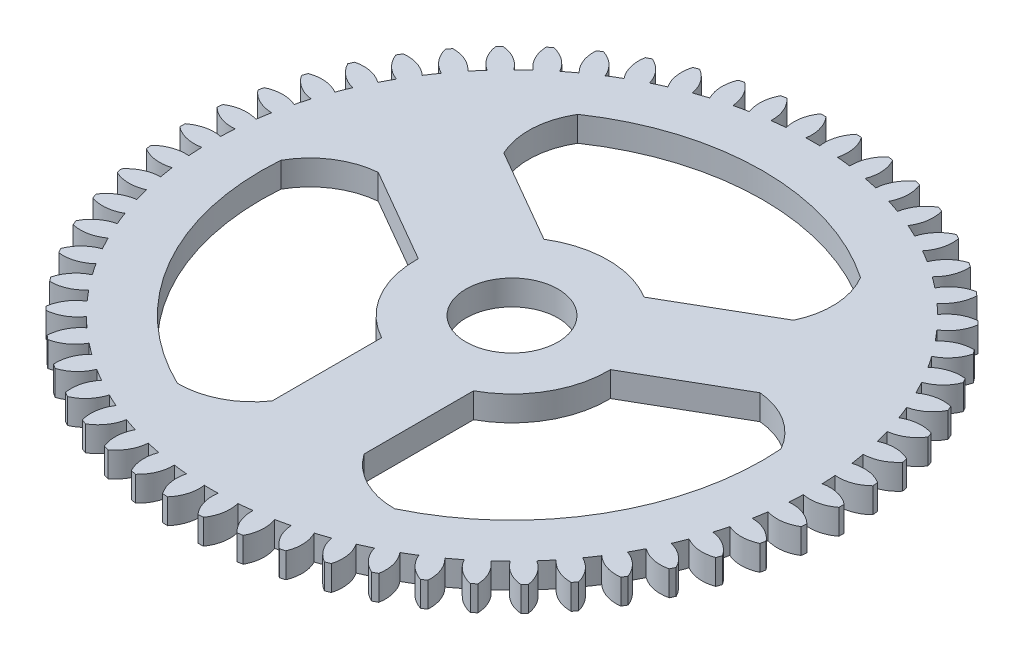
from build123d import *

# Parameters (mm, degrees)
SKETCH1_R           = 11
BOSS_EXTRUDE5_DEPTH = 6
BOSS_EXTRUDE6_DEPTH = 6
CIRPATTERN1_COUNT   = 58
CUT_EXTRUDE1_DEPTH  = 6


with BuildPart() as part:
    # Sketch1 → Boss-Extrude5 (new body)
    with BuildSketch(Plane(origin=(0, 0, 0), x_dir=(1, 0, 0), z_dir=(0, 1, 0))):
        with BuildLine():
            ThreePointArc((71.96481238, -2.250728579), (71.991202557, -1.125501811), (72, 0))
            ThreePointArc((72, 0), (71.991202557, 1.125501811), (71.96481238, 2.250728579))
            ThreePointArc((71.96481238, 2.250728579), (71.894405797, 3.898001418), (71.786298131, 5.543230164))
            ThreePointArc((71.786298131, 5.543230164), (71.577932915, 7.784569327), (71.299605002, 10.018299587))
            ThreePointArc((71.299605002, 10.018299587), (71.051509623, 11.648303752), (70.766155171, 13.272199601))
            ThreePointArc((70.766155171, 13.272199601), (70.316680011, 15.477871695), (69.798474945, 17.668415193))
            ThreePointArc((69.798474945, 17.668415193), (69.375599461, 19.262040374), (68.916343745, 20.845564633))
            ThreePointArc((68.916343745, 20.845564633), (68.231028325, 22.98971017), (67.479021586, 25.111384784))
            ThreePointArc((67.479021586, 25.111384784), (66.886323827, 26.649947184), (66.258551198, 28.174534479))
            ThreePointArc((66.258551198, 28.174534479), (65.345430216, 30.232015312), (64.368438396, 32.259946349))
            ThreePointArc((64.368438396, 32.259946349), (63.6128672, 33.72540773), (62.82393772, 35.173183669))
            ThreePointArc((62.82393772, 35.173183669), (61.693716684, 37.119877717), (60.503194119, 39.030289538))
            ThreePointArc((60.503194119, 39.030289538), (59.593607867, 40.405468706), (58.652771012, 41.759459439))
            ThreePointArc((58.652771012, 41.759459439), (57.318700731, 43.572543494), (55.928605209, 45.343038268))
            ThreePointArc((55.928605209, 45.343038268), (54.875667969, 46.611812504), (53.793954191, 47.856143728))
            ThreePointArc((53.793954191, 47.856143728), (52.271675418, 49.514361037), (50.698304539, 51.124181332))
            ThreePointArc((50.698304539, 51.124181332), (49.514361037, 52.271675418), (48.304452441, 53.391758487))
            ThreePointArc((48.304452441, 53.391758487), (46.611812504, 54.875667969), (44.873612602, 56.305940113))
            ThreePointArc((44.873612602, 56.305940113), (43.572543494, 57.318700731), (42.248625152, 58.301403695))
            ThreePointArc((42.248625152, 58.301403695), (40.405468706, 59.593607867), (38.522818586, 60.827563227))
            ThreePointArc((38.522818586, 60.827563227), (37.119877717, 61.693716684), (35.69747136, 62.52751825))
            ThreePointArc((35.69747136, 62.52751825), (33.72540773, 63.6128672), (31.720379744, 64.636038778))
            ThreePointArc((31.720379744, 64.636038778), (30.232015312, 65.345430216), (28.727797356, 66.020554822))
            ThreePointArc((28.727797356, 66.020554822), (26.649947184, 66.886323827), (24.546048451, 67.686715871))
            ThreePointArc((24.546048451, 67.686715871), (22.98971017, 68.231028325), (21.421316194, 68.739560753))
            ThreePointArc((21.421316194, 68.739560753), (19.262040374, 69.375599461), (17.083937183, 69.943828107))
            ThreePointArc((17.083937183, 69.943828107), (15.477871695, 70.316680011), (13.863689685, 70.652658183))
            ThreePointArc((13.863689685, 70.652658183), (11.648303752, 71.051509623), (9.421532371, 71.380912909))
            ThreePointArc((9.421532371, 71.380912909), (7.784569327, 71.577932915), (6.143524091, 71.737417794))
            ThreePointArc((6.143524091, 71.737417794), (3.898001418, 71.894405797), (1.648668707, 71.981121772))
            ThreePointArc((1.648668707, 71.981121772), (0, 72), (-1.648668707, 71.981121772))
            ThreePointArc((-1.648668707, 71.981121772), (-3.898001418, 71.894405797), (-6.143524091, 71.737417794))
            ThreePointArc((-6.143524091, 71.737417794), (-7.784569327, 71.577932915), (-9.421532371, 71.380912909))
            ThreePointArc((-9.421532371, 71.380912909), (-11.648303752, 71.051509623), (-13.863689685, 70.652658183))
            ThreePointArc((-13.863689685, 70.652658183), (-15.477871695, 70.316680011), (-17.083937183, 69.943828107))
            ThreePointArc((-17.083937183, 69.943828107), (-19.262040374, 69.375599461), (-21.421316194, 68.739560753))
            ThreePointArc((-21.421316194, 68.739560753), (-22.98971017, 68.231028325), (-24.546048451, 67.686715871))
            ThreePointArc((-24.546048451, 67.686715871), (-26.649947184, 66.886323827), (-28.727797356, 66.020554822))
            ThreePointArc((-28.727797356, 66.020554822), (-30.232015312, 65.345430216), (-31.720379744, 64.636038778))
            ThreePointArc((-31.720379744, 64.636038778), (-33.72540773, 63.6128672), (-35.69747136, 62.52751825))
            ThreePointArc((-35.69747136, 62.52751825), (-37.119877717, 61.693716684), (-38.522818586, 60.827563227))
            ThreePointArc((-38.522818586, 60.827563227), (-40.405468706, 59.593607867), (-42.248625152, 58.301403695))
            ThreePointArc((-42.248625152, 58.301403695), (-43.572543494, 57.318700731), (-44.873612602, 56.305940113))
            ThreePointArc((-44.873612602, 56.305940113), (-46.611812504, 54.875667969), (-48.304452441, 53.391758487))
            ThreePointArc((-48.304452441, 53.391758487), (-49.514361037, 52.271675418), (-50.698304539, 51.124181332))
            ThreePointArc((-50.698304539, 51.124181332), (-52.271675418, 49.514361037), (-53.793954191, 47.856143728))
            ThreePointArc((-53.793954191, 47.856143728), (-54.875667969, 46.611812504), (-55.928605209, 45.343038268))
            ThreePointArc((-55.928605209, 45.343038268), (-57.318700731, 43.572543494), (-58.652771012, 41.759459439))
            ThreePointArc((-58.652771012, 41.759459439), (-59.593607867, 40.405468706), (-60.503194119, 39.030289538))
            ThreePointArc((-60.503194119, 39.030289538), (-61.693716684, 37.119877717), (-62.82393772, 35.173183669))
            ThreePointArc((-62.82393772, 35.173183669), (-63.6128672, 33.72540773), (-64.368438396, 32.259946349))
            ThreePointArc((-64.368438396, 32.259946349), (-65.345430216, 30.232015312), (-66.258551198, 28.174534479))
            ThreePointArc((-66.258551198, 28.174534479), (-66.886323827, 26.649947184), (-67.479021586, 25.111384784))
            ThreePointArc((-67.479021586, 25.111384784), (-68.231028325, 22.98971017), (-68.916343745, 20.845564633))
            ThreePointArc((-68.916343745, 20.845564633), (-69.375599461, 19.262040374), (-69.798474945, 17.668415193))
            ThreePointArc((-69.798474945, 17.668415193), (-70.316680011, 15.477871695), (-70.766155171, 13.272199601))
            ThreePointArc((-70.766155171, 13.272199601), (-71.051509623, 11.648303752), (-71.299605002, 10.018299587))
            ThreePointArc((-71.299605002, 10.018299587), (-71.577932915, 7.784569327), (-71.786298131, 5.543230164))
            ThreePointArc((-71.786298131, 5.543230164), (-71.894405797, 3.898001418), (-71.96481238, 2.250728579))
            ThreePointArc((-71.96481238, 2.250728579), (-72, 0), (-71.96481238, -2.250728579))
            ThreePointArc((-71.96481238, -2.250728579), (-71.894405797, -3.898001418), (-71.786298131, -5.543230164))
            ThreePointArc((-71.786298131, -5.543230164), (-71.577932915, -7.784569327), (-71.299605002, -10.018299587))
            ThreePointArc((-71.299605002, -10.018299587), (-71.051509623, -11.648303752), (-70.766155171, -13.272199601))
            ThreePointArc((-70.766155171, -13.272199601), (-70.316680011, -15.477871695), (-69.798474945, -17.668415193))
            ThreePointArc((-69.798474945, -17.668415193), (-69.375599461, -19.262040374), (-68.916343745, -20.845564633))
            ThreePointArc((-68.916343745, -20.845564633), (-68.231028325, -22.98971017), (-67.479021586, -25.111384784))
            ThreePointArc((-67.479021586, -25.111384784), (-66.886323827, -26.649947184), (-66.258551198, -28.174534479))
            ThreePointArc((-66.258551198, -28.174534479), (-65.345430216, -30.232015312), (-64.368438396, -32.259946349))
            ThreePointArc((-64.368438396, -32.259946349), (-63.6128672, -33.72540773), (-62.82393772, -35.173183669))
            ThreePointArc((-62.82393772, -35.173183669), (-61.693716684, -37.119877717), (-60.503194119, -39.030289538))
            ThreePointArc((-60.503194119, -39.030289538), (-59.593607867, -40.405468706), (-58.652771012, -41.759459439))
            ThreePointArc((-58.652771012, -41.759459439), (-57.318700731, -43.572543494), (-55.928605209, -45.343038268))
            ThreePointArc((-55.928605209, -45.343038268), (-54.875667969, -46.611812504), (-53.793954191, -47.856143728))
            ThreePointArc((-53.793954191, -47.856143728), (-52.271675418, -49.514361037), (-50.698304539, -51.124181332))
            ThreePointArc((-50.698304539, -51.124181332), (-49.514361037, -52.271675418), (-48.304452441, -53.391758487))
            ThreePointArc((-48.304452441, -53.391758487), (-46.611812504, -54.875667969), (-44.873612602, -56.305940113))
            ThreePointArc((-44.873612602, -56.305940113), (-43.572543494, -57.318700731), (-42.248625152, -58.301403695))
            ThreePointArc((-42.248625152, -58.301403695), (-40.405468706, -59.593607867), (-38.522818586, -60.827563227))
            ThreePointArc((-38.522818586, -60.827563227), (-37.119877717, -61.693716684), (-35.69747136, -62.52751825))
            ThreePointArc((-35.69747136, -62.52751825), (-33.72540773, -63.6128672), (-31.720379744, -64.636038778))
            ThreePointArc((-31.720379744, -64.636038778), (-30.232015312, -65.345430216), (-28.727797356, -66.020554822))
            ThreePointArc((-28.727797356, -66.020554822), (-26.649947184, -66.886323827), (-24.546048451, -67.686715871))
            ThreePointArc((-24.546048451, -67.686715871), (-22.98971017, -68.231028325), (-21.421316194, -68.739560753))
            ThreePointArc((-21.421316194, -68.739560753), (-19.262040374, -69.375599461), (-17.083937183, -69.943828107))
            ThreePointArc((-17.083937183, -69.943828107), (-15.477871695, -70.316680011), (-13.863689685, -70.652658183))
            ThreePointArc((-13.863689685, -70.652658183), (-11.648303752, -71.051509623), (-9.421532371, -71.380912909))
            ThreePointArc((-9.421532371, -71.380912909), (-7.784569327, -71.577932915), (-6.143524091, -71.737417794))
            ThreePointArc((-6.143524091, -71.737417794), (-3.898001418, -71.894405797), (-1.648668707, -71.981121772))
            ThreePointArc((-1.648668707, -71.981121772), (0, -72), (1.648668707, -71.981121772))
            ThreePointArc((1.648668707, -71.981121772), (3.898001418, -71.894405797), (6.143524091, -71.737417794))
            ThreePointArc((6.143524091, -71.737417794), (7.784569327, -71.577932915), (9.421532371, -71.380912909))
            ThreePointArc((9.421532371, -71.380912909), (11.648303752, -71.051509623), (13.863689685, -70.652658183))
            ThreePointArc((13.863689685, -70.652658183), (15.477871695, -70.316680011), (17.083937183, -69.943828107))
            ThreePointArc((17.083937183, -69.943828107), (19.262040374, -69.375599461), (21.421316194, -68.739560753))
            ThreePointArc((21.421316194, -68.739560753), (22.98971017, -68.231028325), (24.546048451, -67.686715871))
            ThreePointArc((24.546048451, -67.686715871), (26.649947184, -66.886323827), (28.727797356, -66.020554822))
            ThreePointArc((28.727797356, -66.020554822), (30.232015312, -65.345430216), (31.720379744, -64.636038778))
            ThreePointArc((31.720379744, -64.636038778), (33.72540773, -63.6128672), (35.69747136, -62.52751825))
            ThreePointArc((35.69747136, -62.52751825), (37.119877717, -61.693716684), (38.522818586, -60.827563227))
            ThreePointArc((38.522818586, -60.827563227), (40.405468706, -59.593607867), (42.248625152, -58.301403695))
            ThreePointArc((42.248625152, -58.301403695), (43.572543494, -57.318700731), (44.873612602, -56.305940113))
            ThreePointArc((44.873612602, -56.305940113), (46.611812504, -54.875667969), (48.304452441, -53.391758487))
            ThreePointArc((48.304452441, -53.391758487), (49.514361037, -52.271675418), (50.698304539, -51.124181332))
            ThreePointArc((50.698304539, -51.124181332), (52.271675418, -49.514361037), (53.793954191, -47.856143728))
            ThreePointArc((53.793954191, -47.856143728), (54.875667969, -46.611812504), (55.928605209, -45.343038268))
            ThreePointArc((55.928605209, -45.343038268), (57.318700731, -43.572543494), (58.652771012, -41.759459439))
            ThreePointArc((58.652771012, -41.759459439), (59.593607867, -40.405468706), (60.503194119, -39.030289538))
            ThreePointArc((60.503194119, -39.030289538), (61.693716684, -37.119877717), (62.82393772, -35.173183669))
            ThreePointArc((62.82393772, -35.173183669), (63.6128672, -33.72540773), (64.368438396, -32.259946349))
            ThreePointArc((64.368438396, -32.259946349), (65.345430216, -30.232015312), (66.258551198, -28.174534479))
            ThreePointArc((66.258551198, -28.174534479), (66.886323827, -26.649947184), (67.479021586, -25.111384784))
            ThreePointArc((67.479021586, -25.111384784), (68.231028325, -22.98971017), (68.916343745, -20.845564633))
            ThreePointArc((68.916343745, -20.845564633), (69.375599461, -19.262040374), (69.798474945, -17.668415193))
            ThreePointArc((69.798474945, -17.668415193), (70.316680011, -15.477871695), (70.766155171, -13.272199601))
            ThreePointArc((70.766155171, -13.272199601), (71.051509623, -11.648303752), (71.299605002, -10.018299587))
            ThreePointArc((71.299605002, -10.018299587), (71.577932915, -7.784569327), (71.786298131, -5.543230164))
            ThreePointArc((71.786298131, -5.543230164), (71.894405797, -3.898001418), (71.96481238, -2.250728579))
        make_face()
        Circle(SKETCH1_R, mode=Mode.SUBTRACT)
    extrude(amount=BOSS_EXTRUDE5_DEPTH)

    # Sketch1<10> → Boss-Extrude6 (add)
    with BuildSketch(Plane(origin=(0, 0, 0), x_dir=(1, 0, 0), z_dir=(0, 1, 0))):
        with BuildLine():
            ThreePointArc((-71.96481238, -2.250728579), (-72, 0), (-71.96481238, 2.250728579))
            ThreePointArc((-71.96481238, 2.250728579), (-75.5882742, 2.203998802), (-78.85487683, 0.635252012))
            ThreePointArc((-78.85487683, 0.635252012), (-78.85530681, 0), (-78.85487683, -0.635252012))
            ThreePointArc((-78.85487683, -0.635252012), (-75.5882742, -2.203998802), (-71.96481238, -2.250728579))
        make_face()
    boss_extrude6 = extrude(amount=BOSS_EXTRUDE6_DEPTH)

    # CirPattern1: Boss-Extrude6 ×58 about axis
    cirpattern1_axis = Axis((0, 6, 0), (0, 1, 0))
    for i in range(1, CIRPATTERN1_COUNT):
        add(boss_extrude6.rotate(cirpattern1_axis, i * 360 / CIRPATTERN1_COUNT))

    # Sketch3 → Cut-Extrude1 (cut)
    with BuildSketch(Plane(origin=(0, 6, 0), x_dir=(1, 0, 0), z_dir=(0, 1, 0))):
        with BuildLine():
            ThreePointArc((-11.992855685, 19.62578438), (0, 23), (11.992855685, 19.62578438))
            Line((11.992855685, 19.62578438), (34.674348993, 32.720950647))
            ThreePointArc((34.674348993, 32.720950647), (36.343733364, 41.242304423), (33.829477896, 49.553672168))
            ThreePointArc((33.829477896, 49.553672168), (0, 60), (-33.829477896, 49.553672168))
            ThreePointArc((-33.829477896, 49.553672168), (-36.343733364, 41.242304423), (-34.674348993, 32.720950647))
            Line((-34.674348993, 32.720950647), (-11.992855685, 19.62578438))
        make_face()
        with BuildLine():
            Line((45.674348993, 13.668391764), (22.992855685, 0.573225497))
            ThreePointArc((22.992855685, 0.573225497), (19.918584287, -11.5), (11, -20.199009877))
            Line((11, -20.199009877), (11, -46.389342411))
            ThreePointArc((11, -46.389342411), (17.545016659, -52.095748573), (26, -54.074023338))
            ThreePointArc((26, -54.074023338), (51.961524227, -30), (59.829477896, 4.520351171))
            ThreePointArc((59.829477896, 4.520351171), (53.888750023, 10.85344415), (45.674348993, 13.668391764))
        make_face()
        with BuildLine():
            ThreePointArc((-11, -20.199009877), (-19.918584287, -11.5), (-22.992855685, 0.573225497))
            Line((-22.992855685, 0.573225497), (-45.674348993, 13.668391764))
            ThreePointArc((-45.674348993, 13.668391764), (-53.888750023, 10.85344415), (-59.829477896, 4.520351171))
            ThreePointArc((-59.829477896, 4.520351171), (-51.961524227, -30), (-26, -54.074023338))
            ThreePointArc((-26, -54.074023338), (-17.545016659, -52.095748573), (-11, -46.389342411))
            Line((-11, -46.389342411), (-11, -20.199009877))
        make_face()
    extrude(amount=-CUT_EXTRUDE1_DEPTH, mode=Mode.SUBTRACT)


solid = part.part
